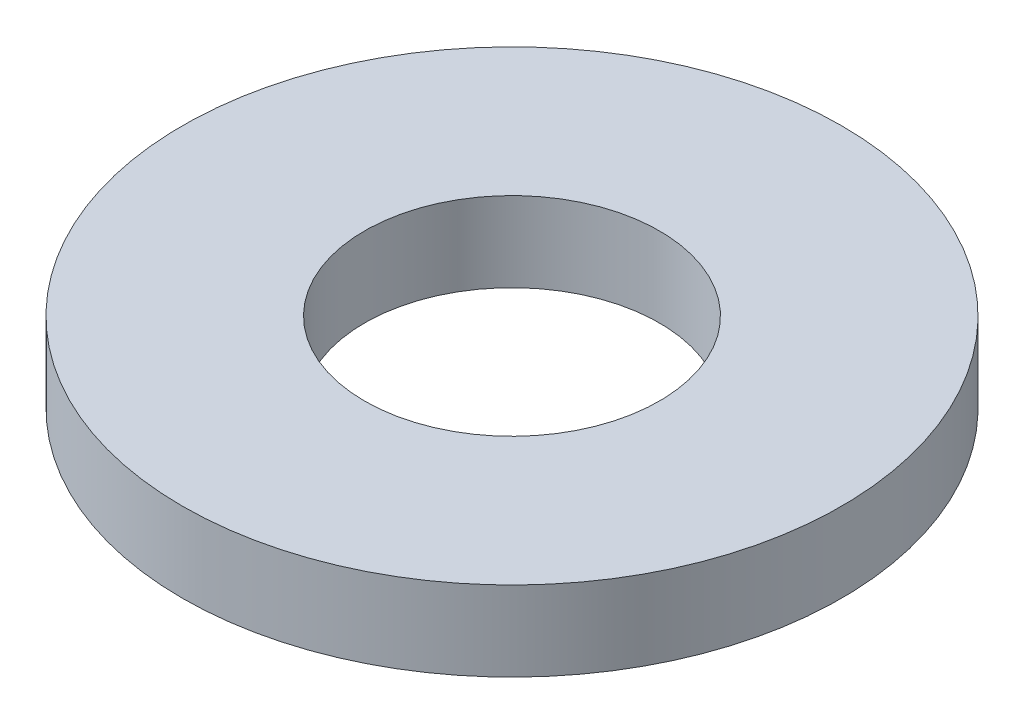
from build123d import *

# Parameters (mm, degrees)
SKETCH1_R           = 95
BOSS_EXTRUDE1_DEPTH = 23
SKETCH2_R           = 42.5
CUT_EXTRUDE1_DEPTH  = 137.304805491


with BuildPart() as part:
    # Sketch1 → Boss-Extrude1 (new body)
    with BuildSketch(Plane(origin=(0, 0, 0), x_dir=(1, 0, 0), z_dir=(0, 1, 0))):
        Circle(SKETCH1_R)
    extrude(amount=BOSS_EXTRUDE1_DEPTH)

    # Sketch2 → Cut-Extrude1 (cut, through all)
    with BuildSketch(Plane(origin=(0, 0, 0), x_dir=(1, 0, 0), z_dir=(0, 1, 0))):
        Circle(SKETCH2_R)
    extrude(amount=CUT_EXTRUDE1_DEPTH, mode=Mode.SUBTRACT)


solid = part.part
